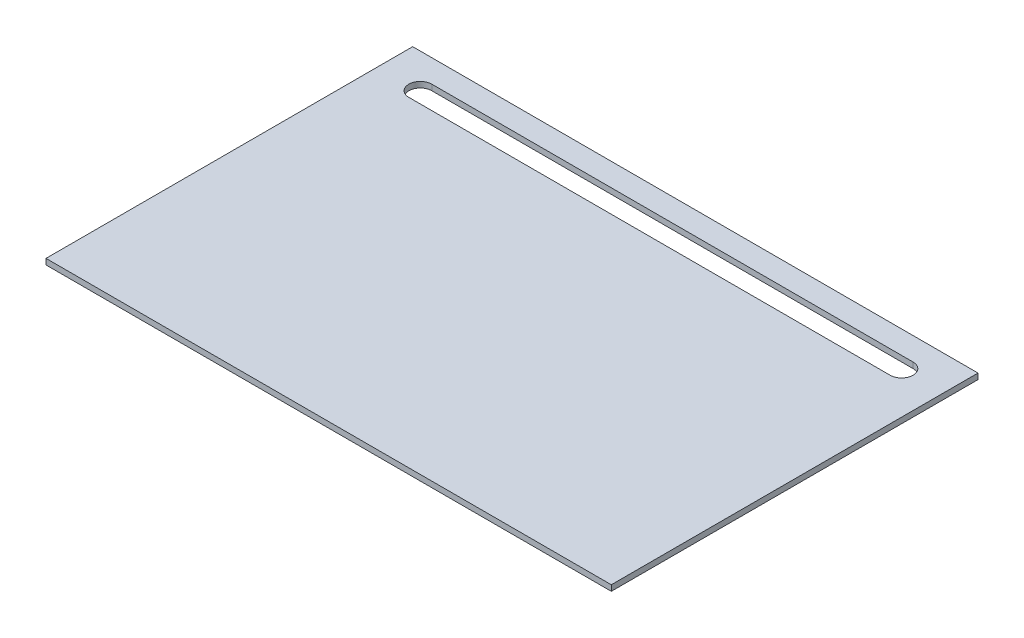
from build123d import *

# Parameters (mm, degrees)
SKETCH1_W           = 558.8
SKETCH1_H           = 304.8
BOSS_EXTRUDE1_DEPTH = 2.38125
SKETCH2_W           = 38.1
SKETCH2_H           = 266.7
CUT_EXTRUDE1_DEPTH  = 319.296719126
SKETCH4_W           = 44.45
SKETCH4_H           = 304.8
CUT_EXTRUDE3_DEPTH  = 319.296719126


with BuildPart() as part:
    # Sketch1 → Boss-Extrude1 (new, symmetric)
    with BuildSketch(Plane(origin=(0, 0, 0), x_dir=(1, 0, 0), z_dir=(0, 1, 0))):
        Rectangle(SKETCH1_W, SKETCH1_H)
    extrude(amount=BOSS_EXTRUDE1_DEPTH, both=True)

    # Sketch2 → Cut-Extrude1 (cut, through all)
    with BuildSketch(Plane(origin=(0, 2.38125, 0), x_dir=(1, 0, 0), z_dir=(0, 1, 0))):
        with Locations((-260.35, 0)):
            Rectangle(SKETCH2_W, SKETCH2_H)
        with Locations((260.35, 0)):
            Rectangle(SKETCH2_W, SKETCH2_H)
    extrude(amount=-CUT_EXTRUDE1_DEPTH, mode=Mode.SUBTRACT)

    # Sketch4 → Cut-Extrude3 (cut, through all)
    with BuildSketch(Plane(origin=(0, 2.38125, 0), x_dir=(1, 0, 0), z_dir=(0, 1, 0))):
        with BuildLine():
            Line((-200.025, 133.35), (200.025, 133.35))
            ThreePointArc((200.025, 133.35), (209.55, 123.825), (200.025, 114.3))
            Line((200.025, 114.3), (-200.025, 114.3))
            ThreePointArc((-200.025, 114.3), (-209.55, 123.825), (-200.025, 133.35))
        make_face()
        with Locations((-257.175, 0)):
            Rectangle(SKETCH4_W, SKETCH4_H)
        with Locations((257.175, 0)):
            Rectangle(SKETCH4_W, SKETCH4_H)
    extrude(amount=-CUT_EXTRUDE3_DEPTH, mode=Mode.SUBTRACT)


solid = part.part
